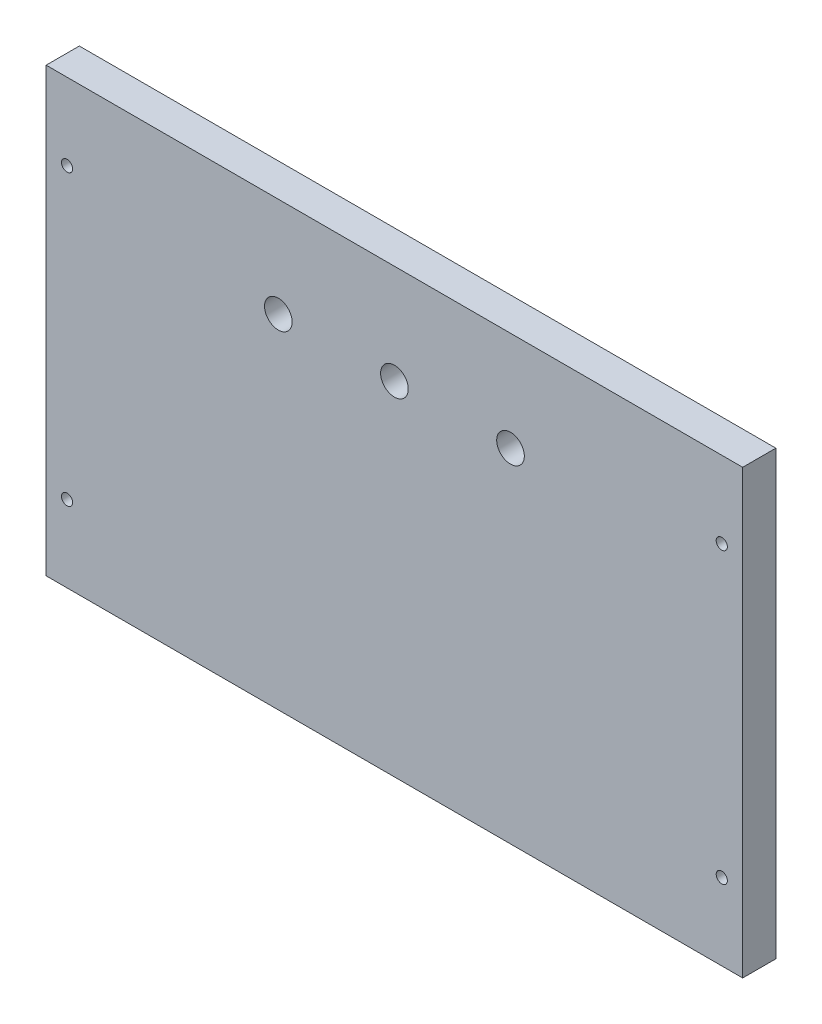
from build123d import *

# Parameters (mm, degrees)
SKETCH1_W           = 200
SKETCH1_H           = 127
SKETCH1_R           = 3.96875
SKETCH1_R_2         = 1.6
BOSS_EXTRUDE1_DEPTH = 9.525


with BuildPart() as part:
    # Sketch1 → Boss-Extrude1 (new body)
    with BuildSketch(Plane.XY):
        with Locations((100, 63.5)):
            Rectangle(SKETCH1_W, SKETCH1_H)
        with Locations((66.666666667, 98.425)):
            Circle(SKETCH1_R, mode=Mode.SUBTRACT)
        with Locations((100, 98.425)):
            Circle(SKETCH1_R, mode=Mode.SUBTRACT)
        with Locations((133.333333333, 98.425)):
            Circle(SKETCH1_R, mode=Mode.SUBTRACT)
        with Locations((6, 105)):
            Circle(SKETCH1_R_2, mode=Mode.SUBTRACT)
        with Locations((6, 22)):
            Circle(SKETCH1_R_2, mode=Mode.SUBTRACT)
        with Locations((194, 22)):
            Circle(SKETCH1_R_2, mode=Mode.SUBTRACT)
        with Locations((194, 105)):
            Circle(SKETCH1_R_2, mode=Mode.SUBTRACT)
    extrude(amount=BOSS_EXTRUDE1_DEPTH)


solid = part.part
